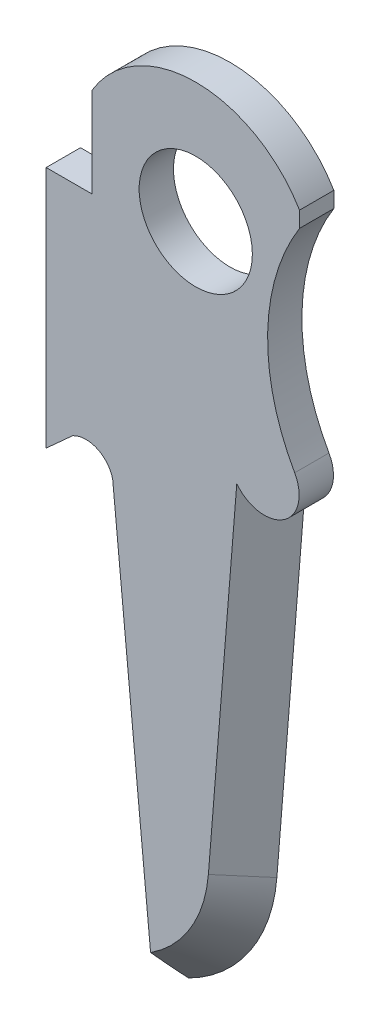
from build123d import *

# Parameters (mm, degrees)
BOSS_EXTRUDE1_DEPTH = 1.27
SKETCH2_R           = 2.0955
CUT_EXTRUDE1_DEPTH  = 67.984946971
CHAMFER1_SIZE       = 1.27


with BuildPart() as part:
    # Sketch1 → Boss-Extrude1 (new body)
    with BuildSketch(Plane.XY):
        with BuildLine():
            Line((41.346078307, 38.223115267), (41.346078307, 29.226984353))
            Line((41.346078307, 29.226984353), (42.327409422, 30.115984353))
            ThreePointArc((42.327409422, 30.115984353), (43.232863688, 30.154994662), (43.809226811, 29.455584353))
            Line((43.809226811, 29.455584353), (45.345946242, 13.605984353))
            ThreePointArc((45.345946242, 13.605984353), (47.617277769, 15.604942198), (48.616615569, 18.460831434))
            Line((48.616615569, 18.460831434), (49.637067337, 31.131984353))
            ThreePointArc((49.637067337, 31.131984353), (50.585693925, 31.847551598), (50.544785665, 33.035093345))
            ThreePointArc((50.544785665, 33.035093345), (49.545142222, 37.023211652), (50.724981076, 40.961784353))
            Line((50.724981076, 40.961784353), (50.724981076, 41.545984353))
            ThreePointArc((50.724981076, 41.545984353), (46.883278307, 43.730384353), (43.041575539, 41.545984353))
            Line((43.041575539, 41.545984353), (43.041575539, 38.223115267))
            Line((43.041575539, 38.223115267), (41.346078307, 38.223115267))
        make_face()
    extrude(amount=BOSS_EXTRUDE1_DEPTH)

    # Sketch2 → Cut-Extrude1 (cut, through all)
    with BuildSketch(Plane.XY.offset(1.27)):
        with Locations((46.883278307, 39.259984353)):
            Circle(SKETCH2_R)
    extrude(amount=-CUT_EXTRUDE1_DEPTH, mode=Mode.SUBTRACT)

    # Chamfer1
    chamfer1_edges = [part.edges().sort_by_distance(p)[0] for p in [
        (47.617277769, 15.604942198, 1.27),
        (49.126841453, 24.796407893, 1.27),
    ]]
    chamfer(chamfer1_edges, length=CHAMFER1_SIZE - 0.0001)  # a hair under: the kernel refuses the full size


solid = part.part
